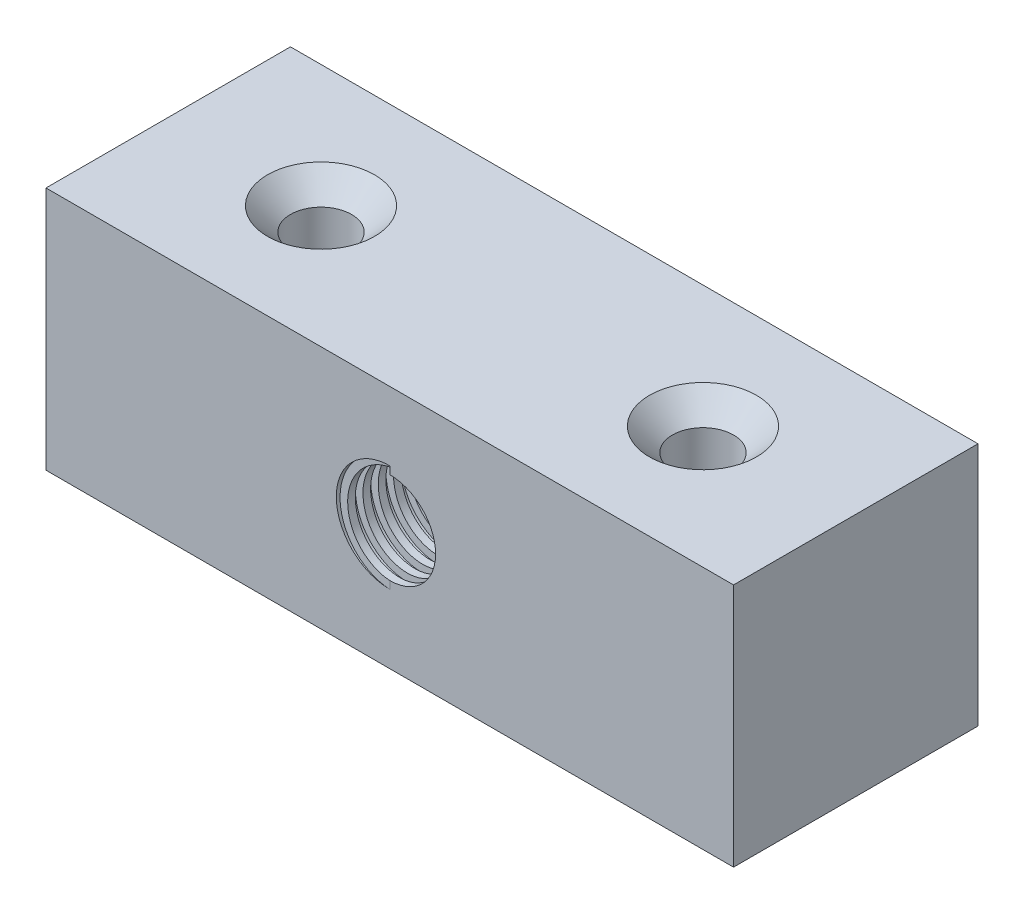
from build123d import *

# Parameters (mm, degrees)
SKETCH1_W              = 90
SKETCH1_H              = 32
BOSS_EXTRUDE1_DEPTH    = 16
F_8_0MM_DOWEL_HOLE1_D  = 8
CHAMFER1_SIZE          = 3
F_12_0MM_DOWEL_HOLE1_D = 12
CUT_SWEEP5_PITCH       = 2


with BuildPart() as part:
    # Sketch1 → Boss-Extrude1 (new, symmetric)
    with BuildSketch(Plane.XY):
        Rectangle(SKETCH1_W, SKETCH1_H)
    extrude(amount=BOSS_EXTRUDE1_DEPTH, both=True)

    # Ø8.0mm Dowel Hole1 (through all)
    with Locations(Plane(origin=(0, 16, 0), x_dir=(1, 0, 0), z_dir=(0, 1, 0))):
        with Locations((-25, 0), (25, 0)):
            Hole(F_8_0MM_DOWEL_HOLE1_D / 2)

    # Chamfer1
    chamfer1_edges = [part.edges().sort_by_distance(p)[0] for p in [
        (29, 16, 0),
        (-21, 16, 0),
    ]]
    chamfer(chamfer1_edges, length=CHAMFER1_SIZE)

    # Ø12.0mm Dowel Hole1 (through all)
    with Locations(Plane(origin=(0, 0, -16), x_dir=(-1, 0, 0), z_dir=(0, 0, -1))):
        with Locations((0, 0)):
            Hole(F_12_0MM_DOWEL_HOLE1_D / 2)

    # Cut-Sweep5: arcs per turn and ends read off the stored shape
    # Cut-Sweep5: the profile of Sketch10 screwed along a right-hand helix through 18.25 turns, 10 arcs to a turn; built about Z, then put on its axis
    cut_sweep5_z = Axis((0, 0, 0), (0, 0, 1))
    cut_sweep5_corners = [(5, -0.026488574, -1.500702138), (7, -0.026488574, -1.500702138), (7, 0.026488574, -2.499297862), (5, 0.026488574, -2.499297862)]
    with BuildLine(mode=Mode.PRIVATE) as cut_sweep5_profile:
        Line(cut_sweep5_corners[0], cut_sweep5_corners[1])
        Line(cut_sweep5_corners[1], cut_sweep5_corners[2])
        Line(cut_sweep5_corners[2], cut_sweep5_corners[3])
        Line(cut_sweep5_corners[3], cut_sweep5_corners[0])
    cut_sweep5_cap = Face(cut_sweep5_profile.wire())
    cut_sweep5_turn_angles = [0, 18, 36, 54, 72, 90, 108, 126, 144, 162, 180, 198, 216, 234, 252, 270, 288, 306, 324, 342, 360]
    cut_sweep5_turn_weights = [1, 0.9510565162951535, 1, 0.9510565162951535, 1, 0.9510565162951535, 1, 0.9510565162951535, 1, 0.9510565162951535, 1, 0.9510565162951535, 1, 0.9510565162951535, 1, 0.9510565162951535, 1, 0.9510565162951535, 1, 0.9510565162951535, 1]
    cut_sweep5_turn_rails = [Edge.make_bspline([Vector(p[0], p[1], 0).rotate(cut_sweep5_z, cut_sweep5_turn_angles[k]) / cut_sweep5_turn_weights[k] + Vector(0, 0, p[2] + CUT_SWEEP5_PITCH * cut_sweep5_turn_angles[k] / 360) for k in range(21)], [0, 0, 0, 1, 1, 2, 2, 3, 3, 4, 4, 5, 5, 6, 6, 7, 7, 8, 8, 9, 9, 10, 10, 10], 2, cut_sweep5_turn_weights) for p in cut_sweep5_corners]
    cut_sweep5_turn_sides = [Face.make_surface_from_curves(cut_sweep5_turn_rails[p[0]], cut_sweep5_turn_rails[p[1]]) for p in [(0, 1), (1, 2), (2, 3), (3, 0)]]
    cut_sweep5_last_angles = [6480, 6498, 6516, 6534, 6552, 6561, 6570]
    cut_sweep5_last_weights = [1, 0.9510565162951535, 1, 0.9510565162951535, 1, 0.9876883405951378, 1]
    cut_sweep5_last_rails = [Edge.make_bspline([Vector(p[0], p[1], 0).rotate(cut_sweep5_z, cut_sweep5_last_angles[k]) / cut_sweep5_last_weights[k] + Vector(0, 0, p[2] + CUT_SWEEP5_PITCH * cut_sweep5_last_angles[k] / 360) for k in range(7)], [0, 0, 0, 1, 1, 2, 2, 3, 3, 3], 2, cut_sweep5_last_weights) for p in cut_sweep5_corners]
    cut_sweep5_last_sides = [Face.make_surface_from_curves(cut_sweep5_last_rails[p[0]], cut_sweep5_last_rails[p[1]]) for p in [(0, 1), (1, 2), (2, 3), (3, 0)]]
    cut_sweep5 = Plane(origin=(0, 0, -16), x_dir=(-1, 0, 0), z_dir=(0, 0, 1)) * Solid(Shell([*[p.moved(Location((0, 0, CUT_SWEEP5_PITCH * i))) for i in range(18) for p in cut_sweep5_turn_sides], *cut_sweep5_last_sides, cut_sweep5_cap, cut_sweep5_cap.rotate(cut_sweep5_z, 6570).moved(Location((0, 0, CUT_SWEEP5_PITCH * 6570 / 360)))]))
    add(cut_sweep5, mode=Mode.SUBTRACT)


solid = part.part
